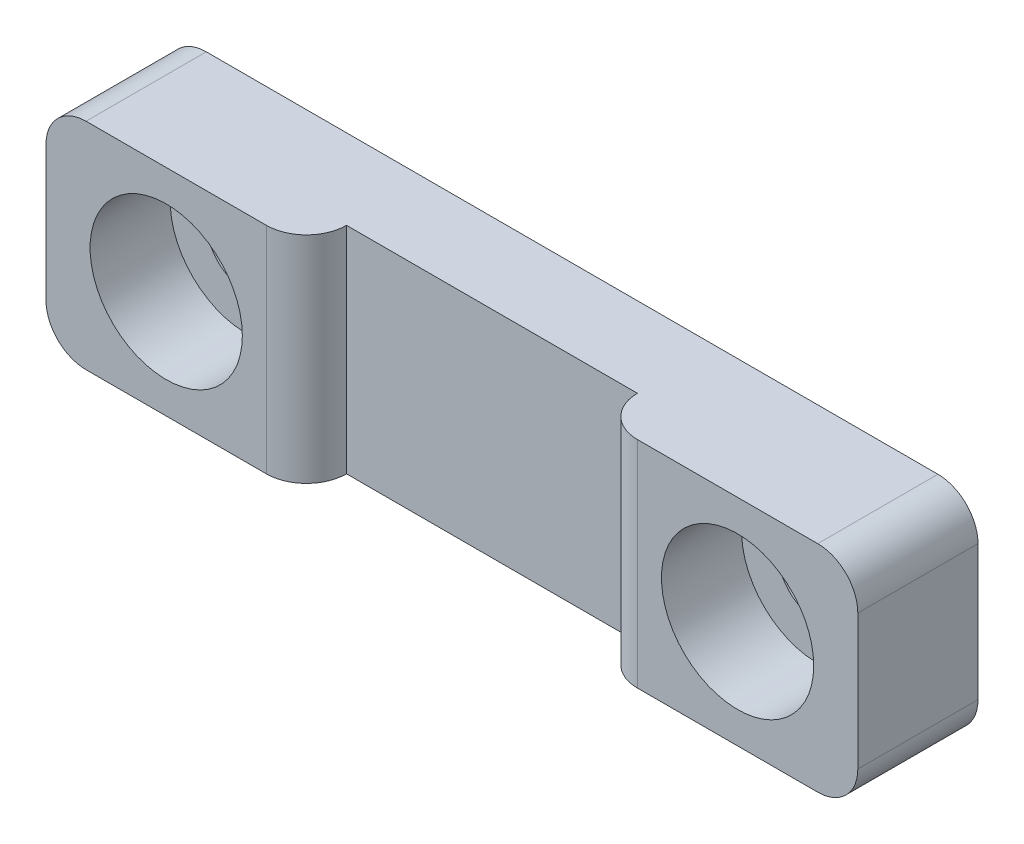
from build123d import *

# Parameters (mm, degrees)
SKETCH1_R           = 1.9
BOSS_EXTRUDE1_DEPTH = 2
BOSS_EXTRUDE2_START = 1
SKETCH2_R           = 1
BOSS_EXTRUDE2_DEPTH = 1
SKETCH3_W           = 7.26
SKETCH3_H           = 2.991248821
CUT_EXTRUDE1_DEPTH  = 10
FILLET1_R           = 1


with BuildPart() as part:
    # Sketch1 → Boss-Extrude1 (new body)
    with BuildSketch(Plane.XY):
        with BuildLine():
            Line((1, 0), (19.26, 0))
            ThreePointArc((19.26, 0), (19.967106781, 0.292893219), (20.26, 1))
            Line((20.26, 1), (20.26, 4.371699928))
            ThreePointArc((20.26, 4.371699928), (19.967106781, 5.078806709), (19.26, 5.371699928))
            Line((19.26, 5.371699928), (1, 5.371699928))
            ThreePointArc((1, 5.371699928), (0.292893219, 5.078806709), (0, 4.371699928))
            Line((0, 4.371699928), (0, 1))
            ThreePointArc((0, 1), (0.292893219, 0.292893219), (1, 0))
        make_face()
        with Locations((3, 2.685849964)):
            Circle(SKETCH1_R, mode=Mode.SUBTRACT)
        with Locations((17.26, 2.685849964)):
            Circle(SKETCH1_R, mode=Mode.SUBTRACT)
    extrude(amount=BOSS_EXTRUDE1_DEPTH)

    # Sketch2 → Boss-Extrude2 (add)
    with BuildSketch(Plane(origin=(0, 0, 0), x_dir=(-1, 0, 0), z_dir=(0, 0, -1)).offset(BOSS_EXTRUDE2_START)):
        with BuildLine():
            Line((-19.26, 0), (-1, 0))
            ThreePointArc((-1, 0), (-0.292893219, 0.292893219), (0, 1))
            Line((0, 1), (0, 4.371699928))
            ThreePointArc((0, 4.371699928), (-0.292893219, 5.078806709), (-1, 5.371699928))
            Line((-1, 5.371699928), (-19.26, 5.371699928))
            ThreePointArc((-19.26, 5.371699928), (-19.967106781, 5.078806709), (-20.26, 4.371699928))
            Line((-20.26, 4.371699928), (-20.26, 1))
            ThreePointArc((-20.26, 1), (-19.967106781, 0.292893219), (-19.26, 0))
        make_face()
        with Locations((-17.26, 2.685849964)):
            Circle(SKETCH2_R, mode=Mode.SUBTRACT)
        with Locations((-3, 2.685849964)):
            Circle(SKETCH2_R, mode=Mode.SUBTRACT)
    extrude(amount=-BOSS_EXTRUDE2_DEPTH)

    # Sketch3 → Cut-Extrude1 (cut)
    with BuildSketch(Plane.XZ):
        with Locations((10.13, 2.495624411)):
            Rectangle(SKETCH3_W, SKETCH3_H)
    extrude(amount=-CUT_EXTRUDE1_DEPTH, mode=Mode.SUBTRACT)

    # Fillet1
    fillet1_edges = [part.edges().sort_by_distance(p)[0] for p in [
        (13.76, 2.685849964, 2),
        (6.5, 2.685849964, 2),
    ]]
    fillet(fillet1_edges, radius=FILLET1_R - 0.0001)  # a hair under: the kernel refuses the full size


solid = part.part
